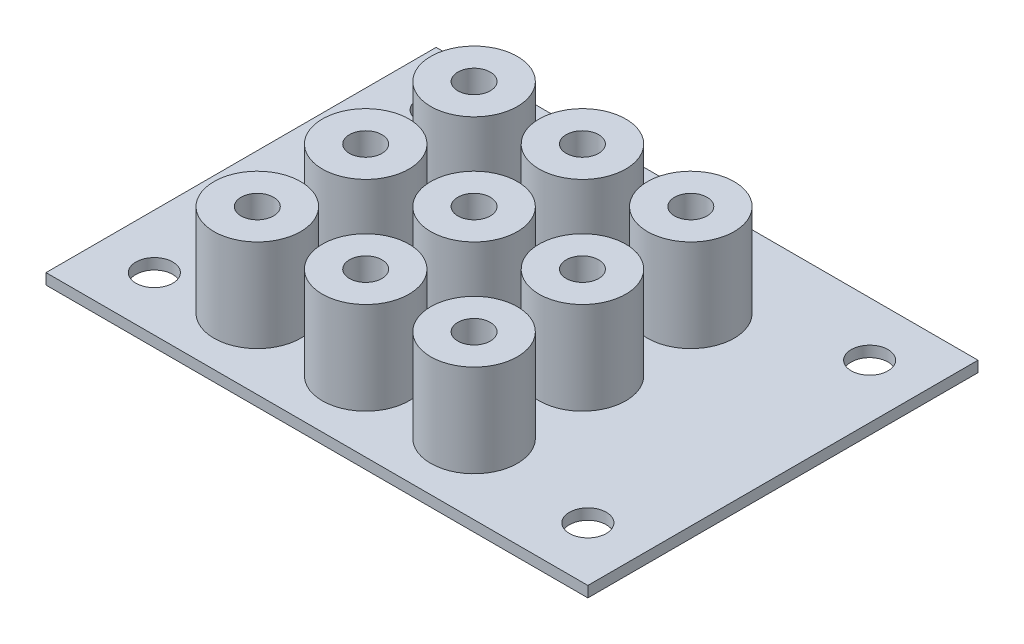
from build123d import *

# Parameters (mm, degrees)
SKETCH1_W           = 50
SKETCH1_H           = 36
SKETCH1_R           = 1.7
SKETCH1_R_2         = 1.25
BOSS_EXTRUDE1_DEPTH = 1
SKETCH2_R           = 4
SKETCH2_R_2         = 1.5
BOSS_EXTRUDE2_DEPTH = 8.525


with BuildPart() as part:
    # Sketch1 → Boss-Extrude1 (new body)
    with BuildSketch(Plane(origin=(0, 0, 0), x_dir=(1, 0, 0), z_dir=(0, 1, 0))):
        with Locations((25, 18)):
            Rectangle(SKETCH1_W, SKETCH1_H)
        with Locations((5, 5)):
            Circle(SKETCH1_R, mode=Mode.SUBTRACT)
        with Locations((13, 6.5)):
            Circle(SKETCH1_R_2, mode=Mode.SUBTRACT)
        with Locations((23, 6.5)):
            Circle(SKETCH1_R_2, mode=Mode.SUBTRACT)
        with Locations((13, 16.5)):
            Circle(SKETCH1_R_2, mode=Mode.SUBTRACT)
        with Locations((23, 16.5)):
            Circle(SKETCH1_R_2, mode=Mode.SUBTRACT)
        with Locations((33, 6.5)):
            Circle(SKETCH1_R_2, mode=Mode.SUBTRACT)
        with Locations((45, 5)):
            Circle(SKETCH1_R, mode=Mode.SUBTRACT)
        with Locations((33, 16.5)):
            Circle(SKETCH1_R_2, mode=Mode.SUBTRACT)
        with Locations((13, 26.5)):
            Circle(SKETCH1_R_2, mode=Mode.SUBTRACT)
        with Locations((23, 26.5)):
            Circle(SKETCH1_R_2, mode=Mode.SUBTRACT)
        with Locations((5, 31)):
            Circle(SKETCH1_R, mode=Mode.SUBTRACT)
        with Locations((33, 26.5)):
            Circle(SKETCH1_R_2, mode=Mode.SUBTRACT)
        with Locations((45, 31)):
            Circle(SKETCH1_R, mode=Mode.SUBTRACT)
    extrude(amount=BOSS_EXTRUDE1_DEPTH)

    # Sketch2 → Boss-Extrude2 (add)
    # profile 1 of 9: a face of its own
    with BuildSketch(Plane(origin=(0, 1, 0), x_dir=(1, 0, 0), z_dir=(0, 1, 0))):
        with Locations((13, 26.5)):
            Circle(SKETCH2_R)
        with Locations((13, 26.5)):
            Circle(SKETCH2_R_2, mode=Mode.SUBTRACT)
    # profile 2 of 9: a face of its own
    with BuildSketch(Plane(origin=(0, 1, 0), x_dir=(1, 0, 0), z_dir=(0, 1, 0))):
        with Locations((23, 26.5)):
            Circle(SKETCH2_R)
        with Locations((23, 26.5)):
            Circle(SKETCH2_R_2, mode=Mode.SUBTRACT)
    # profile 3 of 9: a face of its own
    with BuildSketch(Plane(origin=(0, 1, 0), x_dir=(1, 0, 0), z_dir=(0, 1, 0))):
        with Locations((33, 26.5)):
            Circle(SKETCH2_R)
        with Locations((33, 26.5)):
            Circle(SKETCH2_R_2, mode=Mode.SUBTRACT)
    # profile 4 of 9: a face of its own
    with BuildSketch(Plane(origin=(0, 1, 0), x_dir=(1, 0, 0), z_dir=(0, 1, 0))):
        with Locations((23, 16.5)):
            Circle(SKETCH2_R)
        with Locations((23, 16.5)):
            Circle(SKETCH2_R_2, mode=Mode.SUBTRACT)
    # profile 5 of 9: a face of its own
    with BuildSketch(Plane(origin=(0, 1, 0), x_dir=(1, 0, 0), z_dir=(0, 1, 0))):
        with Locations((33, 16.5)):
            Circle(SKETCH2_R)
        with Locations((33, 16.5)):
            Circle(SKETCH2_R_2, mode=Mode.SUBTRACT)
    # profile 6 of 9: a face of its own
    with BuildSketch(Plane(origin=(0, 1, 0), x_dir=(1, 0, 0), z_dir=(0, 1, 0))):
        with Locations((23, 6.5)):
            Circle(SKETCH2_R)
        with Locations((23, 6.5)):
            Circle(SKETCH2_R_2, mode=Mode.SUBTRACT)
    # profile 7 of 9: a face of its own
    with BuildSketch(Plane(origin=(0, 1, 0), x_dir=(1, 0, 0), z_dir=(0, 1, 0))):
        with Locations((33, 6.5)):
            Circle(SKETCH2_R)
        with Locations((33, 6.5)):
            Circle(SKETCH2_R_2, mode=Mode.SUBTRACT)
    # profile 8 of 9: a face of its own
    with BuildSketch(Plane(origin=(0, 1, 0), x_dir=(1, 0, 0), z_dir=(0, 1, 0))):
        with Locations((13, 16.5)):
            Circle(SKETCH2_R)
        with Locations((13, 16.5)):
            Circle(SKETCH2_R_2, mode=Mode.SUBTRACT)
    # profile 9 of 9: a face of its own
    with BuildSketch(Plane(origin=(0, 1, 0), x_dir=(1, 0, 0), z_dir=(0, 1, 0))):
        with Locations((13, 6.5)):
            Circle(SKETCH2_R)
        with Locations((13, 6.5)):
            Circle(SKETCH2_R_2, mode=Mode.SUBTRACT)
    extrude(amount=BOSS_EXTRUDE2_DEPTH)


solid = part.part
